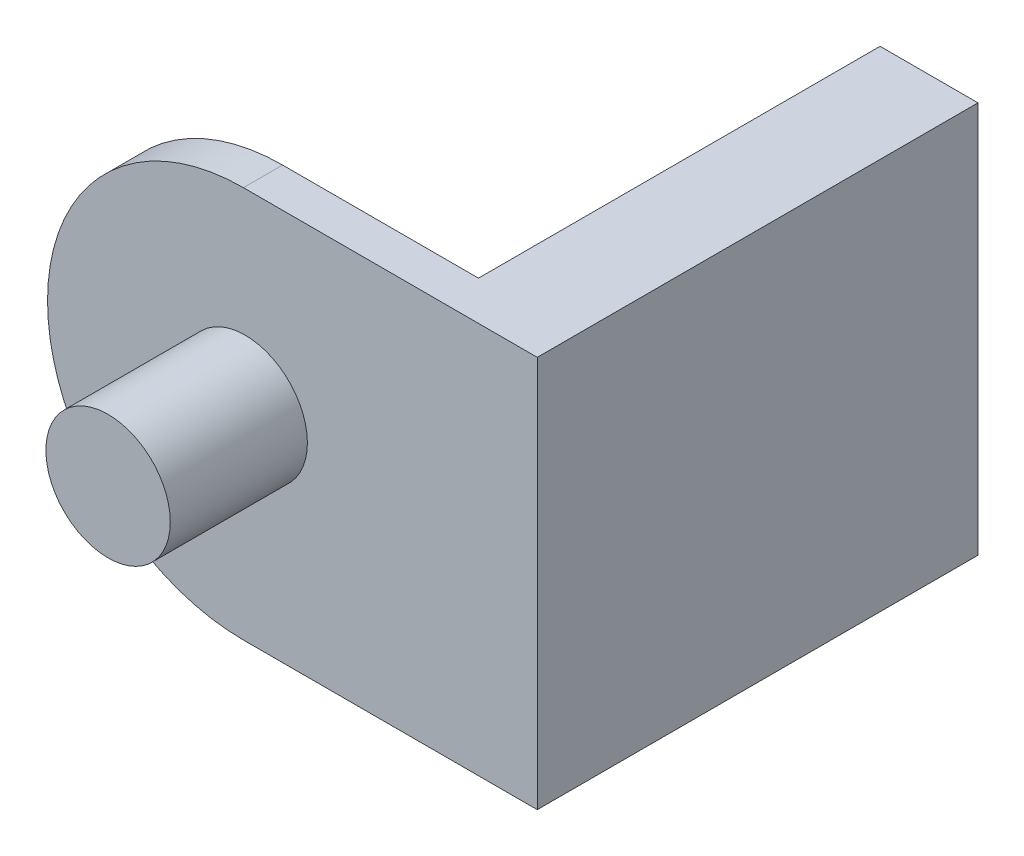
from build123d import *

# Parameters (mm, degrees)
ESQUISSE1_W             = 5
ESQUISSE1_H             = 20
BOSS_EXTRU_1_DEPTH      = 20.5
ESQUISSE2_W             = 25
ESQUISSE2_H             = 20
BOSS_EXTRU_2_DEPTH      = 2
ESQUISSE3_R             = 3.175
BOSS_EXTRU_3_DEPTH      = 7
CONG_1_R                = 10
ESQUISSE4_R             = 1.05
ENL_V_MAT_EXTRU_1_DEPTH = 8


with BuildPart() as part:
    # Esquisse1 → Boss.-Extru.1 (new body)
    with BuildSketch(Plane.XY):
        Rectangle(ESQUISSE1_W, ESQUISSE1_H)
    extrude(amount=BOSS_EXTRU_1_DEPTH)

    # Esquisse2 → Boss.-Extru.2 (add)
    with BuildSketch(Plane.XY.offset(20.5)):
        with Locations((-10, 0)):
            Rectangle(ESQUISSE2_W, ESQUISSE2_H)
    extrude(amount=BOSS_EXTRU_2_DEPTH)

    # Esquisse3 → Boss.-Extru.3 (add)
    with BuildSketch(Plane.XY.offset(22.5)):
        with Locations((-12.41, 0.35)):
            Circle(ESQUISSE3_R)
    extrude(amount=BOSS_EXTRU_3_DEPTH)

    # Congé1
    cong_1_edges = [part.edges().sort_by_distance(p)[0] for p in [
        (-22.5, 10, 21.5),
        (-22.5, -10, 21.5),
    ]]
    fillet(cong_1_edges, radius=CONG_1_R - 0.0001)  # a hair under: the kernel refuses the full size

    # Esquisse4 → Enlèv. mat.-Extru.1 (cut)
    with BuildSketch(Plane(origin=(0, 0, 0), x_dir=(-1, 0, 0), z_dir=(0, 0, -1))):
        with Locations((0, 5)):
            Circle(ESQUISSE4_R)
        with Locations((0, -5)):
            Circle(ESQUISSE4_R)
    extrude(amount=-ENL_V_MAT_EXTRU_1_DEPTH, mode=Mode.SUBTRACT)


solid = part.part
